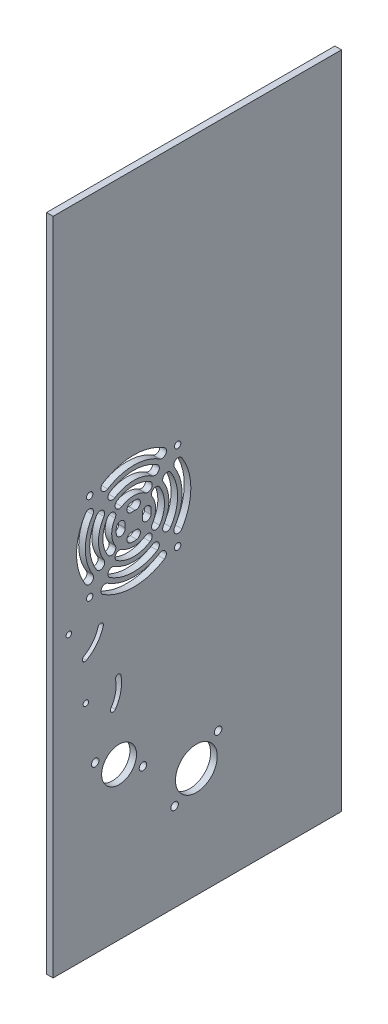
from build123d import *

# Parameters (mm, degrees)
SKETCH1_W                    = 131.144223413
SKETCH1_H                    = 300
TRANSMISSION_DEPTH           = 1.5
BEARINGHOLES_DEPTH           = 182.628738272
BEARINGHOLES_DEPTH_BACK      = 182.628738272
SKETCH9_R                    = 7.9375
SKETCH9_R_2                  = 9.5
BEARINGCOVERHOLES_D          = 3.4
TENSIONER_DEPTH              = 182.628738272
TENSIONER_DEPTH_BACK         = 182.628738272
TENSIONERSKETCH_R            = 1.25
M2_5CLEARANCEHOLES_FOR_FAN_D = 2.9
CUT_EXTRUDE1_DEPTH           = 182.647319183
CIRPATTERN1_COUNT            = 4


with BuildPart() as part:
    # Sketch1 → Transmission (new, symmetric)
    with BuildSketch(Plane(origin=(0, 0, 0), x_dir=(0, 0, -1), z_dir=(1, 0, 0))):
        with Locations((0.427888293, 19.206230873)):
            Rectangle(SKETCH1_W, SKETCH1_H)
    extrude(amount=TRANSMISSION_DEPTH, both=True)

    # Sketch9 → BearingHoles (cut, two sides: drawn at the far end of the back side and taken through both)
    with BuildSketch(Plane(origin=(0, 0, 0), x_dir=(0, 0, -1), z_dir=(1, 0, 0)).offset(-BEARINGHOLES_DEPTH_BACK)):
        with Locations((-35.144223413, -61.691843551)):
            Circle(SKETCH9_R)
        with Locations((0, -80.793769127)):
            Circle(SKETCH9_R_2)
    extrude(amount=BEARINGHOLES_DEPTH + BEARINGHOLES_DEPTH_BACK, mode=Mode.SUBTRACT)

    # BearingCoverHoles (through all)
    with Locations(Plane(origin=(1.5, 0, 0), x_dir=(0, 0, -1), z_dir=(1, 0, 0))):
        with Locations((-46.005463475, -55.504480274), (-24.282983351, -67.879206828), (9.899494937, -70.89427419), (-9.899494937, -90.693264063)):
            Hole(BEARINGCOVERHOLES_D / 2)

    # TensionerSketch → Tensioner (cut, two sides: drawn at the far end of the back side and taken through both)
    with BuildSketch(Plane(origin=(0, 0, 0), x_dir=(0, 0, -1), z_dir=(1, 0, 0)).offset(-TENSIONER_DEPTH_BACK)):
        with Locations((-57.971968062, 0.915433776)):
            Circle(TENSIONERSKETCH_R)
        with Locations((-50.256862686, -30.005053497)):
            Circle(TENSIONERSKETCH_R)
        with BuildLine():
            ThreePointArc((-50.012960328, -13.252018214), (-45.197154562, -9.127804748), (-42.326198348, -3.474599258))
            ThreePointArc((-42.326198348, -3.474599258), (-43.192024246, -1.933383662), (-44.733239842, -2.79920956))
            ThreePointArc((-44.733239842, -2.79920956), (-47.162510485, -7.582691129), (-51.237423056, -11.072410216))
            ThreePointArc((-51.237423056, -11.072410216), (-51.714995691, -12.774445579), (-50.012960328, -13.252018214))
        make_face()
        with BuildLine():
            ThreePointArc((-36.814039033, -39.134839487), (-34.343495215, -33.295530013), (-34.295617338, -26.955275318))
            ThreePointArc((-34.295617338, -26.955275318), (-35.758003764, -25.962085536), (-36.751193546, -27.424471961))
            ThreePointArc((-36.751193546, -27.424471961), (-36.791705595, -32.789302857), (-38.882165749, -37.730257027))
            ThreePointArc((-38.882165749, -37.730257027), (-38.550393621, -39.466611615), (-36.814039033, -39.134839487))
        make_face()
    extrude(amount=TENSIONER_DEPTH + TENSIONER_DEPTH_BACK, mode=Mode.SUBTRACT)

    # M2.5ClearanceHoles for Fan (through all)
    with Locations(Plane(origin=(1.5, 0, 0), x_dir=(0, 0, -1), z_dir=(1, 0, 0))):
        with Locations((-48.507329511, 10.838891788), (-48.507329511, 50.838891788), (-8.507329511, 10.838891788), (-8.507329511, 50.838891788)):
            Hole(M2_5CLEARANCEHOLES_FOR_FAN_D / 2)

    # Sketch21 → Cut-Extrude1 (cut, symmetric)
    with BuildSketch(Plane(origin=(1.5, 0, 0), x_dir=(0, 0, -1), z_dir=(1, 0, 0))):
        with BuildLine():
            ThreePointArc((-14.537539694, 52.767069379), (-28.507329511, 56.838891788), (-42.477119328, 52.767069379))
            ThreePointArc((-42.477119328, 52.767069379), (-43.089303003, 50.005687271), (-40.327920895, 49.393503596))
            ThreePointArc((-40.327920895, 49.393503596), (-28.507329511, 52.838891788), (-16.686738128, 49.393503596))
            ThreePointArc((-16.686738128, 49.393503596), (-13.925356019, 50.005687271), (-14.537539694, 52.767069379))
        make_face()
        with BuildLine():
            ThreePointArc((-17.761337344, 47.706720704), (-28.507329511, 50.838891788), (-39.253321678, 47.706720704))
            ThreePointArc((-39.253321678, 47.706720704), (-39.865505353, 44.945338596), (-37.104123245, 44.333154921))
            ThreePointArc((-37.104123245, 44.333154921), (-28.507329511, 46.838891788), (-19.910535778, 44.333154921))
            ThreePointArc((-19.910535778, 44.333154921), (-17.149153669, 44.945338596), (-17.761337344, 47.706720704))
        make_face()
        with BuildLine():
            ThreePointArc((-20.985134994, 42.64637203), (-28.507329511, 44.838891788), (-36.029524028, 42.64637203))
            ThreePointArc((-36.029524028, 42.64637203), (-36.641707703, 39.884989921), (-33.880325595, 39.272806246))
            ThreePointArc((-33.880325595, 39.272806246), (-28.507329511, 40.838891788), (-23.134333428, 39.272806246))
            ThreePointArc((-23.134333428, 39.272806246), (-20.372951319, 39.884989921), (-20.985134994, 42.64637203))
        make_face()
        with BuildLine():
            ThreePointArc((-27.11814409, 38.717353812), (-28.507329511, 38.838891788), (-29.896514932, 38.717353812))
            ThreePointArc((-29.896514932, 38.717353812), (-31.518834083, 36.400441951), (-29.201922222, 34.7781228))
            ThreePointArc((-29.201922222, 34.7781228), (-28.507329511, 34.838891788), (-27.8127368, 34.7781228))
            ThreePointArc((-27.8127368, 34.7781228), (-25.495824939, 36.400441951), (-27.11814409, 38.717353812))
        make_face()
    cut_extrude1 = extrude(amount=CUT_EXTRUDE1_DEPTH, both=True, mode=Mode.SUBTRACT)

    # CirPattern1: Cut-Extrude1 ×4 about axis
    cirpattern1_axis = Axis((-1.5, 30.838891788, 28.507329511), (1, 0, 0))
    for i in range(1, CIRPATTERN1_COUNT):
        add(cut_extrude1.rotate(cirpattern1_axis, i * 360 / CIRPATTERN1_COUNT), mode=Mode.SUBTRACT)


solid = part.part
